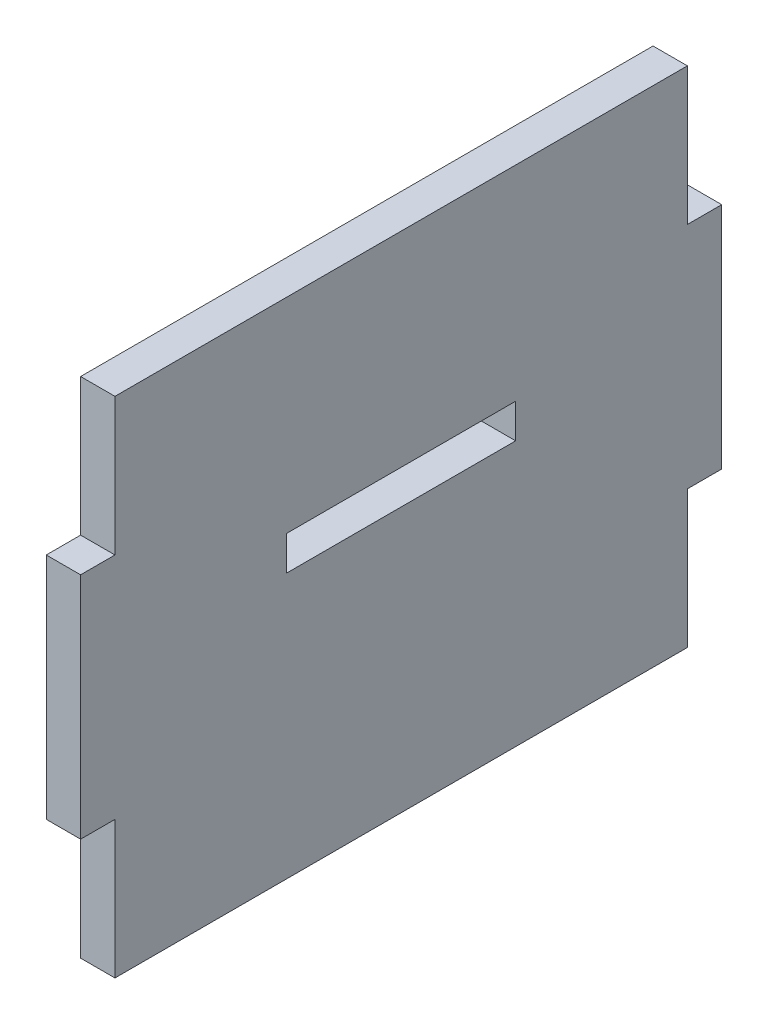
from build123d import *

# Parameters (mm, degrees)
SKETCH1_W           = 20
SKETCH1_H           = 3
BOSS_EXTRUDE1_DEPTH = 3


with BuildPart() as part:
    # Sketch1 → Boss-Extrude1 (new body)
    with BuildSketch(Plane(origin=(0, 0, 0), x_dir=(0, 0, -1), z_dir=(1, 0, 0))):
        Polygon((0, 0), (50, 0), (50, 12), (53, 12), (53, 32), (50, 32), (50, 44), (0, 44), (0, 32), (-3, 32), (-3, 12), (0, 12), align=None)
        with Locations((25, 24.6326732)):
            Rectangle(SKETCH1_W, SKETCH1_H, mode=Mode.SUBTRACT)
    extrude(amount=BOSS_EXTRUDE1_DEPTH)


solid = part.part
